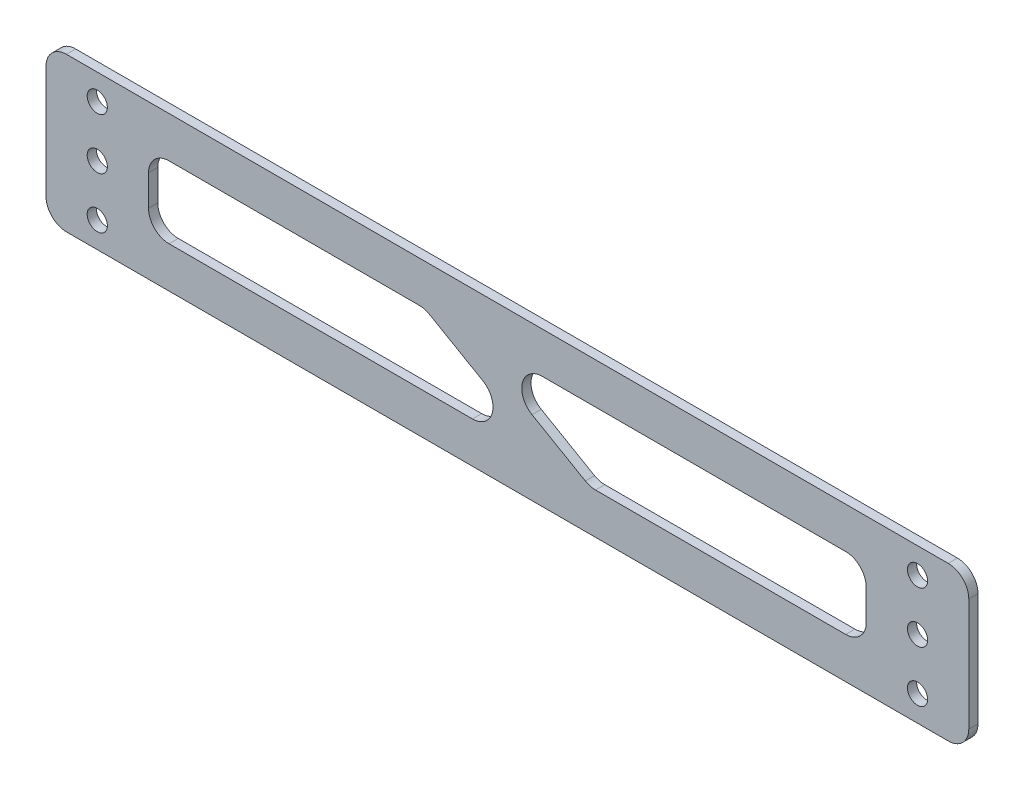
from build123d import *

# Parameters (mm, degrees)
SKETCH1_R           = 2.5
BOSS_EXTRUDE1_DEPTH = 2.286


with BuildPart() as part:
    # Sketch1 → Boss-Extrude1 (new body)
    with BuildSketch(Plane.XY):
        with BuildLine():
            Line((-7.62, 755.65), (210.82, 755.65))
            ThreePointArc((210.82, 755.65), (214.412102448, 757.137897552), (215.9, 760.73))
            Line((215.9, 760.73), (215.9, 788.67))
            ThreePointArc((215.9, 788.67), (214.412102448, 792.262102448), (210.82, 793.75))
            Line((210.82, 793.75), (-7.62, 793.75))
            ThreePointArc((-7.62, 793.75), (-11.212102448, 792.262102448), (-12.7, 788.67))
            Line((-12.7, 788.67), (-12.7, 760.73))
            ThreePointArc((-12.7, 760.73), (-11.212102448, 757.137897552), (-7.62, 755.65))
        make_face()
        with Locations((0, 762)):
            Circle(SKETCH1_R, mode=Mode.SUBTRACT)
        with Locations((0, 774.7)):
            Circle(SKETCH1_R, mode=Mode.SUBTRACT)
        with Locations((0, 787.4)):
            Circle(SKETCH1_R, mode=Mode.SUBTRACT)
        with Locations((203.2, 762)):
            Circle(SKETCH1_R, mode=Mode.SUBTRACT)
        with Locations((203.2, 774.7)):
            Circle(SKETCH1_R, mode=Mode.SUBTRACT)
        with Locations((203.2, 787.4)):
            Circle(SKETCH1_R, mode=Mode.SUBTRACT)
        with BuildLine():
            Line((17.78, 783.59), (79.760886363, 783.59))
            ThreePointArc((79.760886363, 783.59), (81.075687113, 783.416903198), (82.300886363, 782.909409051))
            Line((82.300886363, 782.909409051), (95.499113517, 775.289409051))
            ThreePointArc((95.499113517, 775.289409051), (97.866016715, 769.575199251), (92.959113517, 765.81))
            Line((92.959113517, 765.81), (17.78, 765.81))
            ThreePointArc((17.78, 765.81), (14.187897552, 767.297897552), (12.7, 770.89))
            Line((12.7, 770.89), (12.7, 778.51))
            ThreePointArc((12.7, 778.51), (14.187897552, 782.102102448), (17.78, 783.59))
        make_face(mode=Mode.SUBTRACT)
        with BuildLine():
            Line((190.5, 778.51), (190.5, 770.89))
            ThreePointArc((190.5, 770.89), (189.012102448, 767.297897552), (185.42, 765.81))
            Line((185.42, 765.81), (123.439113517, 765.81))
            ThreePointArc((123.439113517, 765.81), (122.124312768, 765.983096802), (120.899113517, 766.490590949))
            Line((120.899113517, 766.490590949), (107.700886363, 774.110590949))
            ThreePointArc((107.700886363, 774.110590949), (105.333983166, 779.824800749), (110.240886363, 783.59))
            Line((110.240886363, 783.59), (185.42, 783.59))
            ThreePointArc((185.42, 783.59), (189.012102448, 782.102102448), (190.5, 778.51))
        make_face(mode=Mode.SUBTRACT)
    extrude(amount=BOSS_EXTRUDE1_DEPTH)


solid = part.part
